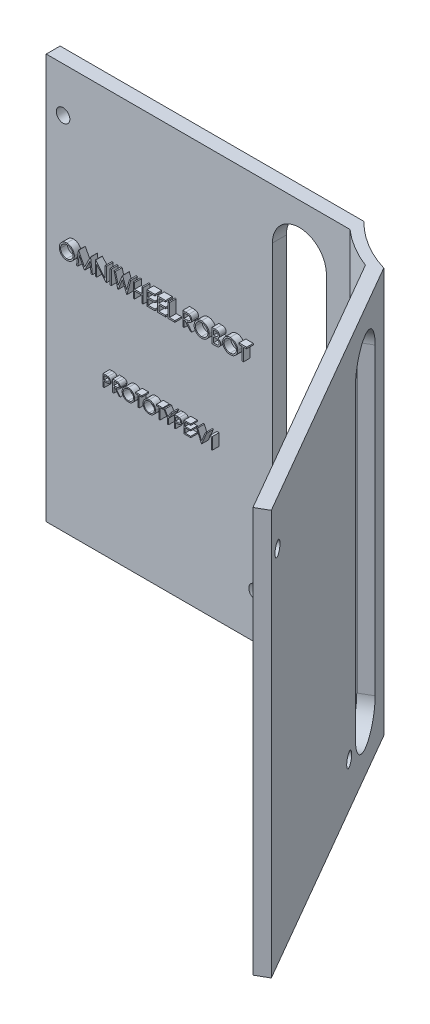
from build123d import *

# Parameters (mm, degrees)
BOSS_EXTRU_1_DEPTH      = 120
ENL_V_MAT_EXTRU_1_DEPTH = 188.009777727
ENL_V_MAT_EXTRU_2_DEPTH = 180.784310366
ESQUISSE6_R             = 2
ENL_V_MAT_EXTRU_3_DEPTH = 188.009777727
ESQUISSE7_R             = 2
ENL_V_MAT_EXTRU_4_DEPTH = 180.784310366
ESQUISSE8_W             = 0.379914529
ESQUISSE8_H             = 4.233333333
BOSS_EXTRU_2_DEPTH      = 2
ESQUISSE9_R             = 2
ENL_V_MAT_EXTRU_5_DEPTH = 188.009777853
ESQUISSE10_R            = 2
ENL_V_MAT_EXTRU_6_DEPTH = 180.784310483


with BuildPart() as part:
    # Esquisse3 → Boss.-Extru.1 (new body)
    with BuildSketch(Plane(origin=(0, 0, 0), x_dir=(1, 0, 0), z_dir=(0, 1, 0))):
        with BuildLine():
            ThreePointArc((-10.103808925, -33.509894736), (-18.121448463, -29.943498553), (-25, -24.494897428))
            Line((-25, -24.494897428), (-115, -24.494897428))
            Line((-115, -24.494897428), (-115, -28.618176043))
            Line((-115, -28.618176043), (-25, -28.618176043))
            ThreePointArc((-25, -28.618176043), (-19.581111, -32.566548666), (-13.552631037, -35.50107311))
            Line((-13.552631037, -35.50107311), (31.963111135, -114.336651096))
            Line((31.963111135, -114.336651096), (35.411933246, -112.345472721))
            Line((35.411933246, -112.345472721), (-10.103808925, -33.509894736))
        make_face()
    extrude(amount=BOSS_EXTRU_1_DEPTH)

    # Esquisse4 → Enlèv. mat.-Extru.1 (cut, through all)
    with BuildSketch(Plane.XY.offset(28.618176043)):
        with BuildLine():
            Line((-48, 105), (-48, 15))
            ThreePointArc((-48, 15), (-40, 7), (-32, 15))
            Line((-32, 15), (-32, 105))
            ThreePointArc((-32, 105), (-40, 113), (-48, 105))
        make_face()
    extrude(amount=-ENL_V_MAT_EXTRU_1_DEPTH, mode=Mode.SUBTRACT)

    # Esquisse5 → Enlèv. mat.-Extru.2 (cut, through all)
    with BuildSketch(Plane(origin=(-25.536888865, 0, 14.743729661), x_dir=(0.4999999999999999, 0, 0.8660254037844386), z_dir=(-0.8660254037844387, 0, 0.49999999999999994))):
        with BuildLine():
            Line((46.968515657, 105), (46.968515657, 15))
            ThreePointArc((46.968515657, 15), (38.968515657, 7), (30.968515657, 15))
            Line((30.968515657, 15), (30.968515657, 105))
            ThreePointArc((30.968515657, 105), (38.968515657, 113), (46.968515657, 105))
        make_face()
    extrude(amount=-ENL_V_MAT_EXTRU_2_DEPTH, mode=Mode.SUBTRACT)

    # Esquisse6 → Enlèv. mat.-Extru.3 (cut, through all)
    with BuildSketch(Plane.XY.offset(28.618176043)):
        with Locations((-110, 106.75)):
            Circle(ESQUISSE6_R)
    extrude(amount=-ENL_V_MAT_EXTRU_3_DEPTH, mode=Mode.SUBTRACT)

    # Esquisse7 → Enlèv. mat.-Extru.4 (cut, through all)
    with BuildSketch(Plane(origin=(-25.536888865, 0, 14.743729661), x_dir=(0.4999999999999999, 0, 0.8660254037844386), z_dir=(-0.8660254037844387, 0, 0.49999999999999994))):
        with Locations((110, 106.75)):
            Circle(ESQUISSE7_R)
    extrude(amount=-ENL_V_MAT_EXTRU_4_DEPTH, mode=Mode.SUBTRACT)

    # Esquisse8 → Boss.-Extru.2 (add)
    # profile 1 of 25: a face of its own
    with BuildSketch(Plane.XY.offset(28.618176043)):
        with BuildLine():
            add(Edge.make_bspline(
                [(-106.927136752, 76.562203816), (-106.848749805, 76.560218407), (-106.694791374, 76.556318902), (-106.468519831, 76.526468938), (-106.252504811, 76.474827848), (-106.044986643, 76.406050716), (-105.848447519, 76.314303031), (-105.661408096, 76.203407661), (-105.484313401, 76.072202802), (-105.319550397, 75.921702689), (-105.168774848, 75.757953178), (-105.035937823, 75.583203706), (-104.924610477, 75.398510869), (-104.833187668, 75.204429674), (-104.761464588, 75.001399046), (-104.71197203, 74.788336585), (-104.680357315, 74.566622779), (-104.67666128, 74.41539981), (-104.674786325, 74.338686188)],
                knots=[0, 0, 0, 0, 1.065120563, 2.091984664, 3.0946048, 4.079830382, 5.057816894, 6.036188127, 7.030412546, 8.04752943, 9.064399622, 10.05169764, 11.02544977, 11.989514704, 12.962713494, 13.945757189, 14.957906945, 16, 16, 16, 16], degree=3))
            add(Edge.make_bspline(
                [(-104.674786325, 74.338686188), (-104.676661005, 74.262537657), (-104.680356217, 74.112440082), (-104.712007977, 73.89213325), (-104.761648043, 73.680356883), (-104.832521622, 73.477464522), (-104.92350863, 73.283242136), (-105.035577265, 73.098200773), (-105.167586158, 72.92227977), (-105.317817302, 72.757406356), (-105.481588086, 72.606218939), (-105.657247552, 72.474478965), (-105.840845186, 72.361117405), (-106.034743595, 72.270664771), (-106.236371259, 72.19836921), (-106.447532735, 72.149077934), (-106.667238567, 72.117283129), (-106.817063496, 72.113632162), (-106.893215812, 72.111776465)],
                knots=[0, 0, 0, 0, 1.043624062, 2.057103931, 3.04512605, 4.022047818, 4.998200453, 5.980619268, 6.982898556, 8.009068085, 9.034988726, 10.034168286, 11.015286542, 11.987931943, 12.962482838, 13.94673481, 14.956375938, 16, 16, 16, 16], degree=3))
            add(Edge.make_bspline(
                [(-106.893215812, 72.111776465), (-106.969929036, 72.113650486), (-107.121151221, 72.117344679), (-107.343143635, 72.149011711), (-107.556355763, 72.198531193), (-107.760177883, 72.269299749), (-107.954723655, 72.36076059), (-108.140373565, 72.472283982), (-108.316382438, 72.604614524), (-108.481291027, 72.754796952), (-108.632178152, 72.918290163), (-108.763725207, 73.093470643), (-108.875273677, 73.276901528), (-108.966427422, 73.469091867), (-109.038593006, 73.669112564), (-109.087826453, 73.878297866), (-109.119680414, 74.095455173), (-109.123351133, 74.243310869), (-109.125213675, 74.318333624)],
                knots=[0, 0, 0, 0, 1.053102029, 2.075944431, 3.073151272, 4.055350789, 5.033113405, 6.020478099, 7.024410459, 8.052272461, 9.079885166, 10.07527673, 11.055994387, 12.023226415, 12.992069828, 13.970394897, 14.97016774, 16, 16, 16, 16], degree=3))
            add(Edge.make_bspline(
                [(-109.125213675, 74.318333624), (-109.124567021, 74.368689328), (-109.12328187, 74.468765478), (-109.107810013, 74.617375556), (-109.085359194, 74.763595685), (-109.053183547, 74.907010069), (-109.011102198, 75.047267641), (-108.961448793, 75.185335707), (-108.900803456, 75.319815068), (-108.832246863, 75.451342789), (-108.7557302, 75.577868542), (-108.671213817, 75.697465752), (-108.581666276, 75.811138006), (-108.483497219, 75.91593962), (-108.37994209, 76.014919375), (-108.269321004, 76.106556186), (-108.152308956, 76.191676364), (-108.028402459, 76.268384777), (-107.900654641, 76.337762016), (-107.768965586, 76.397297017), (-107.635123828, 76.448394634), (-107.498502492, 76.489809727), (-107.359464377, 76.522505618), (-107.217706028, 76.544769751), (-107.073340379, 76.560281069), (-106.976080974, 76.561560143), (-106.927136752, 76.562203816)],
                knots=[0, 0, 0, 0, 1.037015668, 2.060948919, 3.074880161, 4.083647147, 5.086022904, 6.090072063, 7.104153813, 8.122640571, 9.144368836, 10.147691507, 11.138137339, 12.123020368, 13.103399296, 14.087645067, 15.080126199, 16.082011238, 17.087798457, 18.072939717, 19.057185487, 20.037253025, 21.01195951, 21.997135196, 22.992090687, 24, 24, 24, 24], degree=3))
        make_face()
        with BuildLine():
            add(Edge.make_bspline(
                [(-106.908480235, 76.128015782), (-106.948654125, 76.127526057), (-107.02861784, 76.12655129), (-107.147495327, 76.11371133), (-107.26480938, 76.095411369), (-107.380584228, 76.069308005), (-107.494335454, 76.033743103), (-107.607123357, 75.992811719), (-107.717919432, 75.942953829), (-107.826357907, 75.886623034), (-107.93148376, 75.824273387), (-108.030680075, 75.755364678), (-108.124203654, 75.681512903), (-108.21182551, 75.602545709), (-108.293288356, 75.518060953), (-108.370195567, 75.429339435), (-108.439464489, 75.333845243), (-108.502947044, 75.234167894), (-108.559755765, 75.130437219), (-108.610271956, 75.02374529), (-108.651594138, 74.913221803), (-108.685294346, 74.800065822), (-108.713234117, 74.684456561), (-108.730934197, 74.56551701), (-108.743915241, 74.443844827), (-108.744834292, 74.361619156), (-108.745299145, 74.320029671)],
                knots=[0, 0, 0, 0, 1.008559885, 2.007477868, 2.99961109, 3.989939068, 4.984837346, 5.991145699, 7.001802488, 8.033829008, 9.059044045, 10.069351652, 11.065060232, 12.050310815, 13.029377138, 14.011219647, 14.996725999, 15.989392538, 16.977580475, 17.965360261, 18.951710183, 19.937753436, 20.929683414, 21.935841486, 22.955955122, 24, 24, 24, 24], degree=3))
            add(Edge.make_bspline(
                [(-108.745299145, 74.320029671), (-108.743757169, 74.258873461), (-108.740723626, 74.138560276), (-108.714165422, 73.962250236), (-108.673256939, 73.792810118), (-108.612953267, 73.631167047), (-108.537538714, 73.475931581), (-108.444372856, 73.328480826), (-108.333992819, 73.18877493), (-108.208609316, 73.057789224), (-108.071542804, 72.93823287), (-107.925997502, 72.833290461), (-107.773532662, 72.744499016), (-107.613750693, 72.672163357), (-107.447504622, 72.614844341), (-107.273723203, 72.575560664), (-107.093564076, 72.549706541), (-106.970760331, 72.547223684), (-106.908480235, 72.5459645)],
                knots=[0, 0, 0, 0, 1.032063989, 2.030389145, 3.003944642, 3.970395727, 4.937377036, 5.913328081, 6.909231446, 7.93887556, 8.970685674, 9.976071282, 10.964166581, 11.944589148, 12.933237628, 13.927779006, 14.949070134, 16, 16, 16, 16], degree=3))
            add(Edge.make_bspline(
                [(-106.908480235, 72.5459645), (-106.866619219, 72.546539633), (-106.783596251, 72.547680297), (-106.660109286, 72.559169172), (-106.538847011, 72.577592481), (-106.41997951, 72.604118131), (-106.303641691, 72.637316181), (-106.189347977, 72.676756004), (-106.078315759, 72.725960889), (-105.969144336, 72.780326506), (-105.864646025, 72.842302697), (-105.764889905, 72.908872649), (-105.672390386, 72.982615648), (-105.584834081, 73.060409573), (-105.503036781, 73.143822989), (-105.427551628, 73.232747448), (-105.358632802, 73.327744243), (-105.295174353, 73.427270401), (-105.238564692, 73.531284916), (-105.189241401, 73.638363669), (-105.147396575, 73.748242992), (-105.113616384, 73.861081369), (-105.087145397, 73.976664491), (-105.068905875, 74.095147118), (-105.056147287, 74.216292228), (-105.055185622, 74.298230035), (-105.054700855, 74.339534211)],
                knots=[0, 0, 0, 0, 1.047197238, 2.076906641, 3.100256066, 4.114471768, 5.12198147, 6.126382909, 7.136867548, 8.15857795, 9.17633901, 10.174870724, 11.156907918, 12.133735059, 13.104061851, 14.077631395, 15.04955518, 16.038496417, 17.029181396, 18.010275684, 18.986308667, 19.968651475, 20.955262928, 21.950658345, 22.966943676, 24, 24, 24, 24], degree=3))
            add(Edge.make_bspline(
                [(-105.054700855, 74.339534211), (-105.05518601, 74.380555821), (-105.056148406, 74.461929741), (-105.06889978, 74.582229969), (-105.087164667, 74.699860044), (-105.11348718, 74.814358167), (-105.147414509, 74.925753526), (-105.189248709, 75.033941497), (-105.238579499, 75.139325124), (-105.295195161, 75.24164394), (-105.358835252, 75.339826718), (-105.428375909, 75.433688684), (-105.505017806, 75.521467142), (-105.586571188, 75.605329106), (-105.675073116, 75.683485982), (-105.770122691, 75.755963697), (-105.870565997, 75.824511372), (-105.976916081, 75.886348956), (-106.086673054, 75.943455695), (-106.199296603, 75.992382146), (-106.313510847, 76.033956043), (-106.429025345, 76.06941561), (-106.546812376, 76.095309132), (-106.666076055, 76.113727821), (-106.786651377, 76.126546821), (-106.867741748, 76.127524574), (-106.908480235, 76.128015782)],
                knots=[0, 0, 0, 0, 1.02996197, 2.043119294, 3.035359645, 4.018872909, 4.991431989, 5.957985074, 6.929999688, 7.912076566, 8.892894881, 9.867085534, 10.843653904, 11.817741046, 12.803660682, 13.806313499, 14.818574707, 15.856120519, 16.894564902, 17.924820532, 18.937903209, 19.946497019, 20.957711757, 21.963978472, 22.977135795, 24, 24, 24, 24], degree=3))
        make_face(mode=Mode.SUBTRACT)
    # profile 2 of 25: a face of its own
    with BuildSketch(Plane.XY.offset(28.618176043)):
        Polygon((-104.023504274, 72.220323474), (-103.464656784, 76.453656807), (-103.41038328, 76.453656807), (-101.662606838, 72.980152534), (-99.919070513, 76.453656807), (-99.863948985, 76.453656807), (-99.301709402, 72.220323474), (-99.683319979, 72.220323474), (-100.088675214, 75.266423901), (-101.616813568, 72.220323474), (-101.702463942, 72.220323474), (-103.236538462, 75.273208089), (-103.641045673, 72.220323474), align=None)
    # profile 3 of 25: a face of its own
    with BuildSketch(Plane.XY.offset(28.618176043)):
        Polygon((-98.433333333, 72.220323474), (-98.433333333, 76.453656807), (-98.353619124, 76.453656807), (-95.556837607, 73.121772459), (-95.556837607, 76.453656807), (-95.176923077, 76.453656807), (-95.176923077, 72.220323474), (-95.263421474, 72.220323474), (-98.053418803, 75.544575611), (-98.053418803, 72.220323474), align=None)
    # profile 4 of 25: a face of its own
    with BuildSketch(Plane.XY.offset(28.618176043)):
        with Locations((-93.901495727, 74.336990141)):
            Rectangle(ESQUISSE8_W, ESQUISSE8_H)
    # profile 5 of 25: a face of its own
    with BuildSketch(Plane.XY.offset(28.618176043)):
        Polygon((-92.897435897, 76.453656807), (-92.504801015, 76.453656807), (-91.676282051, 73.349042758), (-90.4441039, 76.453656807), (-90.388982372, 76.453656807), (-89.179700855, 73.370243346), (-88.346941774, 76.453656807), (-87.958547009, 76.453656807), (-89.099986645, 72.220323474), (-89.15426015, 72.220323474), (-90.427991453, 75.458077213), (-91.716987179, 72.220323474), (-91.771260684, 72.220323474), align=None)
    # profile 6 of 25: a face of its own
    with BuildSketch(Plane.XY.offset(28.618176043)):
        Polygon((-87.198717949, 76.453656807), (-86.818803419, 76.453656807), (-86.818803419, 74.716904671), (-84.647863248, 74.716904671), (-84.647863248, 76.453656807), (-84.267948718, 76.453656807), (-84.267948718, 72.220323474), (-84.647863248, 72.220323474), (-84.647863248, 74.282716636), (-86.818803419, 74.282716636), (-86.818803419, 72.220323474), (-87.198717949, 72.220323474), align=None)
    # profile 7 of 25: a face of its own
    with BuildSketch(Plane.XY.offset(28.618176043)):
        Polygon((-83.182478632, 76.453656807), (-80.794444444, 76.453656807), (-80.794444444, 76.019468773), (-82.802564103, 76.019468773), (-82.802564103, 74.716904671), (-80.794444444, 74.716904671), (-80.794444444, 74.282716636), (-82.802564103, 74.282716636), (-82.802564103, 72.654511508), (-80.794444444, 72.654511508), (-80.794444444, 72.220323474), (-83.182478632, 72.220323474), align=None)
    # profile 8 of 25: a face of its own
    with BuildSketch(Plane.XY.offset(28.618176043)):
        Polygon((-80.034615385, 76.453656807), (-77.646581197, 76.453656807), (-77.646581197, 76.019468773), (-79.654700855, 76.019468773), (-79.654700855, 74.716904671), (-77.646581197, 74.716904671), (-77.646581197, 74.282716636), (-79.654700855, 74.282716636), (-79.654700855, 72.654511508), (-77.646581197, 72.654511508), (-77.646581197, 72.220323474), (-80.034615385, 72.220323474), align=None)
    # profile 9 of 25: a face of its own
    with BuildSketch(Plane.XY.offset(28.618176043)):
        Polygon((-76.886752137, 76.453656807), (-76.506837607, 76.453656807), (-76.506837607, 72.654511508), (-74.878632479, 72.654511508), (-74.878632479, 72.220323474), (-76.886752137, 72.220323474), align=None)
    # profile 10 of 25: a face of its own
    with BuildSketch(Plane.XY.offset(28.618176043)):
        with BuildLine():
            Line((-72.544871795, 76.453656807), (-71.697696314, 76.453656807))
            add(Edge.make_bspline(
                [(-71.697696314, 76.453656807), (-71.641161806, 76.453468622), (-71.532609289, 76.453107286), (-71.377096857, 76.451092506), (-71.235791702, 76.44531781), (-71.108767705, 76.44034838), (-70.996027199, 76.431286699), (-70.897224476, 76.422625725), (-70.812814594, 76.41128806), (-70.761717231, 76.400758643), (-70.738581731, 76.395991209)],
                knots=[0, 0, 0, 0, 1.410062039, 2.707475311, 3.878576406, 4.937260626, 5.877586885, 6.699081471, 7.410979367, 8, 8, 8, 8], degree=3))
            add(Edge.make_bspline(
                [(-70.738581731, 76.395991209), (-70.707609909, 76.388338836), (-70.646326979, 76.373197335), (-70.558092137, 76.341193818), (-70.474012907, 76.304158653), (-70.394438548, 76.260659677), (-70.319767639, 76.210373991), (-70.249230254, 76.15416969), (-70.182506312, 76.092354308), (-70.122294245, 76.023369309), (-70.065520345, 75.950995626), (-70.017636958, 75.872734892), (-69.976360169, 75.790896663), (-69.943496781, 75.704648644), (-69.917034851, 75.614827262), (-69.898376448, 75.520618908), (-69.887186916, 75.422452776), (-69.886047719, 75.355496068), (-69.885470085, 75.321545429)],
                knots=[0, 0, 0, 0, 1.027469482, 2.033020251, 3.019912614, 3.986113645, 4.951240523, 5.91722682, 6.890402269, 7.87763091, 8.8651537, 9.85103654, 10.82876324, 11.815024772, 12.821070561, 13.842952187, 14.906261191, 16, 16, 16, 16], degree=3))
            add(Edge.make_bspline(
                [(-69.885470085, 75.321545429), (-69.887246874, 75.26513916), (-69.890713848, 75.155075919), (-69.923038497, 74.995345138), (-69.97598724, 74.846344729), (-70.048949694, 74.7082623), (-70.141864679, 74.583789425), (-70.253533712, 74.474460017), (-70.38401909, 74.382971741), (-70.505490739, 74.319528825), (-70.612792675, 74.278897402), (-70.701128206, 74.250308664), (-70.797487312, 74.228220382), (-70.900946755, 74.208432413), (-71.011937081, 74.193492744), (-71.130192272, 74.182550673), (-71.255796665, 74.175711967), (-71.342082967, 74.174693542), (-71.386471688, 74.174169628)],
                knots=[0, 0, 0, 0, 1.260483769, 2.459530307, 3.627416485, 4.787058657, 5.939039949, 7.08810263, 8.267026773, 9.491475466, 10.141966685, 10.831826277, 11.566392101, 12.351337768, 13.187381173, 14.07005841, 15.007169909, 16, 16, 16, 16], degree=3))
            Line((-71.386471688, 74.174169628), (-69.831196581, 72.220323474))
            Line((-69.831196581, 72.220323474), (-70.301001603, 72.220323474))
            Line((-70.301001603, 72.220323474), (-71.856276709, 74.174169628))
            Line((-71.856276709, 74.174169628), (-72.164957265, 74.174169628))
            Line((-72.164957265, 74.174169628), (-72.164957265, 72.220323474))
            Line((-72.164957265, 72.220323474), (-72.544871795, 72.220323474))
            Line((-72.544871795, 72.220323474), (-72.544871795, 76.453656807))
        make_face()
        with BuildLine():
            Line((-72.164957265, 76.019468773), (-72.164957265, 74.608357662))
            Line((-72.164957265, 74.608357662), (-71.389863782, 74.602421497))
            add(Edge.make_bspline(
                [(-71.389863782, 74.602421497), (-71.353674783, 74.602405487), (-71.283530194, 74.602374455), (-71.182050343, 74.607205023), (-71.087562208, 74.612700274), (-71.000427203, 74.621105673), (-70.920606402, 74.631938255), (-70.848139702, 74.645488531), (-70.782908811, 74.661275312), (-70.706831531, 74.685709659), (-70.621878774, 74.724421701), (-70.529554056, 74.78074378), (-70.450932181, 74.851584524), (-70.384507719, 74.932590514), (-70.331132121, 75.02165531), (-70.29350135, 75.117711299), (-70.269622396, 75.218333518), (-70.266805965, 75.287491801), (-70.265384615, 75.322393453)],
                knots=[0, 0, 0, 0, 1.146690395, 2.22261258, 3.21895312, 4.145990853, 4.996080663, 5.770904154, 6.481378293, 7.121626537, 8.300444488, 9.431385265, 10.535395872, 11.636531494, 12.74115979, 13.810798291, 14.895190096, 16, 16, 16, 16], degree=3))
            add(Edge.make_bspline(
                [(-70.265384615, 75.322393453), (-70.266838609, 75.356437404), (-70.269719895, 75.423900092), (-70.293243644, 75.52266486), (-70.333024134, 75.615879171), (-70.386632936, 75.703163834), (-70.451946199, 75.782394581), (-70.528530601, 75.850184947), (-70.614292123, 75.906124776), (-70.694448715, 75.941871503), (-70.766093906, 75.963787897), (-70.828299304, 75.979210733), (-70.89858652, 75.991601662), (-70.977296837, 76.001529507), (-71.064094238, 76.01006263), (-71.159417597, 76.01581002), (-71.262634464, 76.019213455), (-71.334174086, 76.019381687), (-71.371207265, 76.019468773)],
                knots=[0, 0, 0, 0, 1.101028733, 2.181837193, 3.264309656, 4.369019818, 5.486613113, 6.575447106, 7.666700264, 8.788928104, 9.402425223, 10.0903467, 10.862060571, 11.710948788, 12.657782767, 13.684531032, 14.801375019, 16, 16, 16, 16], degree=3))
            Line((-71.371207265, 76.019468773), (-72.164957265, 76.019468773))
        make_face(mode=Mode.SUBTRACT)
    # profile 11 of 25: a face of its own
    with BuildSketch(Plane.XY.offset(28.618176043)):
        with BuildLine():
            add(Edge.make_bspline(
                [(-66.981837607, 76.562203816), (-66.90345066, 76.560218407), (-66.749492228, 76.556318902), (-66.523220685, 76.526468938), (-66.307205665, 76.474827848), (-66.099687497, 76.406050716), (-65.903148373, 76.314303031), (-65.716108951, 76.203407661), (-65.539014256, 76.072202802), (-65.374251252, 75.921702689), (-65.223475702, 75.757953178), (-65.090638678, 75.583203706), (-64.979311332, 75.398510869), (-64.887888523, 75.204429674), (-64.816165443, 75.001399046), (-64.766672885, 74.788336585), (-64.73505817, 74.566622779), (-64.731362135, 74.41539981), (-64.729487179, 74.338686188)],
                knots=[0, 0, 0, 0, 1.065120563, 2.091984664, 3.0946048, 4.079830382, 5.057816894, 6.036188127, 7.030412546, 8.04752943, 9.064399622, 10.05169764, 11.02544977, 11.989514704, 12.962713494, 13.945757189, 14.957906945, 16, 16, 16, 16], degree=3))
            add(Edge.make_bspline(
                [(-64.729487179, 74.338686188), (-64.73136186, 74.262537657), (-64.735057072, 74.112440082), (-64.766708831, 73.89213325), (-64.816348898, 73.680356883), (-64.887222477, 73.477464522), (-64.978209484, 73.283242136), (-65.09027812, 73.098200773), (-65.222287013, 72.92227977), (-65.372518157, 72.757406356), (-65.536288941, 72.606218939), (-65.711948406, 72.474478965), (-65.895546041, 72.361117405), (-66.08944445, 72.270664771), (-66.291072113, 72.19836921), (-66.50223359, 72.149077934), (-66.721939422, 72.117283129), (-66.87176435, 72.113632162), (-66.947916667, 72.111776465)],
                knots=[0, 0, 0, 0, 1.043624062, 2.057103931, 3.04512605, 4.022047818, 4.998200453, 5.980619268, 6.982898556, 8.009068085, 9.034988726, 10.034168286, 11.015286542, 11.987931943, 12.962482838, 13.94673481, 14.956375938, 16, 16, 16, 16], degree=3))
            add(Edge.make_bspline(
                [(-66.947916667, 72.111776465), (-67.024629891, 72.113650486), (-67.175852076, 72.117344679), (-67.39784449, 72.149011711), (-67.611056618, 72.198531193), (-67.814878738, 72.269299749), (-68.00942451, 72.36076059), (-68.19507442, 72.472283982), (-68.371083293, 72.604614524), (-68.535991882, 72.754796952), (-68.686879007, 72.918290163), (-68.818426061, 73.093470643), (-68.929974532, 73.276901528), (-69.021128277, 73.469091867), (-69.093293861, 73.669112564), (-69.142527308, 73.878297866), (-69.174381269, 74.095455173), (-69.178051988, 74.243310869), (-69.17991453, 74.318333624)],
                knots=[0, 0, 0, 0, 1.053102029, 2.075944431, 3.073151272, 4.055350789, 5.033113405, 6.020478099, 7.024410459, 8.052272461, 9.079885166, 10.07527673, 11.055994387, 12.023226415, 12.992069828, 13.970394897, 14.97016774, 16, 16, 16, 16], degree=3))
            add(Edge.make_bspline(
                [(-69.17991453, 74.318333624), (-69.179267876, 74.368689328), (-69.177982725, 74.468765478), (-69.162510868, 74.617375556), (-69.140060048, 74.763595685), (-69.107884402, 74.907010069), (-69.065803052, 75.047267641), (-69.016149648, 75.185335707), (-68.955504311, 75.319815068), (-68.886947718, 75.451342789), (-68.810431055, 75.577868542), (-68.725914672, 75.697465752), (-68.636367131, 75.811138006), (-68.538198074, 75.91593962), (-68.434642945, 76.014919375), (-68.324021859, 76.106556186), (-68.207009811, 76.191676364), (-68.083103314, 76.268384777), (-67.955355495, 76.337762016), (-67.82366644, 76.397297017), (-67.689824683, 76.448394634), (-67.553203346, 76.489809727), (-67.414165232, 76.522505618), (-67.272406883, 76.544769751), (-67.128041234, 76.560281069), (-67.030781829, 76.561560143), (-66.981837607, 76.562203816)],
                knots=[0, 0, 0, 0, 1.037015668, 2.060948919, 3.074880161, 4.083647147, 5.086022904, 6.090072063, 7.104153813, 8.122640571, 9.144368836, 10.147691507, 11.138137339, 12.123020368, 13.103399296, 14.087645067, 15.080126199, 16.082011238, 17.087798457, 18.072939717, 19.057185487, 20.037253025, 21.01195951, 21.997135196, 22.992090687, 24, 24, 24, 24], degree=3))
        make_face()
        with BuildLine():
            add(Edge.make_bspline(
                [(-66.96318109, 76.128015782), (-67.00335498, 76.127526057), (-67.083318695, 76.12655129), (-67.202196182, 76.11371133), (-67.319510235, 76.095411369), (-67.435285082, 76.069308005), (-67.549036309, 76.033743103), (-67.661824212, 75.992811719), (-67.772620287, 75.942953829), (-67.881058762, 75.886623034), (-67.986184615, 75.824273387), (-68.08538093, 75.755364678), (-68.178904509, 75.681512903), (-68.266526365, 75.602545709), (-68.347989211, 75.518060953), (-68.424896422, 75.429339435), (-68.494165344, 75.333845243), (-68.557647899, 75.234167894), (-68.61445662, 75.130437219), (-68.664972811, 75.02374529), (-68.706294993, 74.913221803), (-68.739995201, 74.800065822), (-68.767934972, 74.684456561), (-68.785635051, 74.56551701), (-68.798616096, 74.443844827), (-68.799535147, 74.361619156), (-68.8, 74.320029671)],
                knots=[0, 0, 0, 0, 1.008559885, 2.007477868, 2.99961109, 3.989939068, 4.984837346, 5.991145699, 7.001802488, 8.033829008, 9.059044045, 10.069351652, 11.065060232, 12.050310815, 13.029377138, 14.011219647, 14.996725999, 15.989392538, 16.977580475, 17.965360261, 18.951710183, 19.937753436, 20.929683414, 21.935841486, 22.955955122, 24, 24, 24, 24], degree=3))
            add(Edge.make_bspline(
                [(-68.8, 74.320029671), (-68.798458024, 74.258873461), (-68.795424481, 74.138560276), (-68.768866277, 73.962250236), (-68.727957793, 73.792810118), (-68.667654121, 73.631167047), (-68.592239569, 73.475931581), (-68.499073711, 73.328480826), (-68.388693674, 73.18877493), (-68.26331017, 73.057789224), (-68.126243659, 72.93823287), (-67.980698357, 72.833290461), (-67.828233517, 72.744499016), (-67.668451548, 72.672163357), (-67.502205477, 72.614844341), (-67.328424058, 72.575560664), (-67.148264931, 72.549706541), (-67.025461186, 72.547223684), (-66.96318109, 72.5459645)],
                knots=[0, 0, 0, 0, 1.032063989, 2.030389145, 3.003944642, 3.970395727, 4.937377036, 5.913328081, 6.909231446, 7.93887556, 8.970685674, 9.976071282, 10.964166581, 11.944589148, 12.933237628, 13.927779006, 14.949070134, 16, 16, 16, 16], degree=3))
            add(Edge.make_bspline(
                [(-66.96318109, 72.5459645), (-66.921320074, 72.546539633), (-66.838297106, 72.547680297), (-66.714810141, 72.559169172), (-66.593547865, 72.577592481), (-66.474680365, 72.604118131), (-66.358342546, 72.637316181), (-66.244048831, 72.676756004), (-66.133016613, 72.725960889), (-66.023845191, 72.780326506), (-65.919346879, 72.842302697), (-65.819590759, 72.908872649), (-65.727091241, 72.982615648), (-65.639534935, 73.060409573), (-65.557737635, 73.143822989), (-65.482252483, 73.232747448), (-65.413333656, 73.327744243), (-65.349875208, 73.427270401), (-65.293265547, 73.531284916), (-65.243942256, 73.638363669), (-65.20209743, 73.748242992), (-65.168317238, 73.861081369), (-65.141846251, 73.976664491), (-65.123606729, 74.095147118), (-65.110848142, 74.216292228), (-65.109886477, 74.298230035), (-65.109401709, 74.339534211)],
                knots=[0, 0, 0, 0, 1.047197238, 2.076906641, 3.100256066, 4.114471768, 5.12198147, 6.126382909, 7.136867548, 8.15857795, 9.17633901, 10.174870724, 11.156907918, 12.133735059, 13.104061851, 14.077631395, 15.04955518, 16.038496417, 17.029181396, 18.010275684, 18.986308667, 19.968651475, 20.955262928, 21.950658345, 22.966943676, 24, 24, 24, 24], degree=3))
            add(Edge.make_bspline(
                [(-65.109401709, 74.339534211), (-65.109886865, 74.380555821), (-65.110849261, 74.461929741), (-65.123600635, 74.582229969), (-65.141865521, 74.699860044), (-65.168188035, 74.814358167), (-65.202115364, 74.925753526), (-65.243949563, 75.033941497), (-65.293280354, 75.139325124), (-65.349896016, 75.24164394), (-65.413536107, 75.339826718), (-65.483076763, 75.433688684), (-65.559718661, 75.521467142), (-65.641272043, 75.605329106), (-65.729773971, 75.683485982), (-65.824823546, 75.755963697), (-65.925266851, 75.824511372), (-66.031616936, 75.886348956), (-66.141373909, 75.943455695), (-66.253997458, 75.992382146), (-66.368211702, 76.033956043), (-66.4837262, 76.06941561), (-66.601513231, 76.095309132), (-66.72077691, 76.113727821), (-66.841352232, 76.126546821), (-66.922442602, 76.127524574), (-66.96318109, 76.128015782)],
                knots=[0, 0, 0, 0, 1.02996197, 2.043119294, 3.035359645, 4.018872909, 4.991431989, 5.957985074, 6.929999688, 7.912076566, 8.892894881, 9.867085534, 10.843653904, 11.817741046, 12.803660682, 13.806313499, 14.818574707, 15.856120519, 16.894564902, 17.924820532, 18.937903209, 19.946497019, 20.957711757, 21.963978472, 22.977135795, 24, 24, 24, 24], degree=3))
        make_face(mode=Mode.SUBTRACT)
    # profile 12 of 25: a face of its own
    with BuildSketch(Plane.XY.offset(28.618176043)):
        with BuildLine():
            Line((-63.861111111, 76.453656807), (-63.035136218, 76.453656807))
            add(Edge.make_bspline(
                [(-63.035136218, 76.453656807), (-62.994703678, 76.453444233), (-62.916335352, 76.453032211), (-62.802374694, 76.446642138), (-62.695635656, 76.437929128), (-62.596087284, 76.424104159), (-62.503775577, 76.407422676), (-62.41842234, 76.387221432), (-62.340298988, 76.362998766), (-62.247029298, 76.32447993), (-62.140687165, 76.267241431), (-62.025542442, 76.182661167), (-61.927082077, 76.079207616), (-61.842190055, 75.962509547), (-61.774697272, 75.834135804), (-61.725869646, 75.697146119), (-61.694956787, 75.553307441), (-61.691777633, 75.454558073), (-61.69017094, 75.404651733)],
                knots=[0, 0, 0, 0, 1.001505555, 1.941167018, 2.826882275, 3.653841531, 4.429895133, 5.150066043, 5.825578002, 6.45369114, 7.647487171, 8.808567382, 9.977351308, 11.170798116, 12.373658725, 13.556498008, 14.765093433, 16, 16, 16, 16], degree=3))
            add(Edge.make_bspline(
                [(-61.69017094, 75.404651733), (-61.691493214, 75.357900546), (-61.694091606, 75.266030056), (-61.718938563, 75.131659086), (-61.757837657, 75.003750469), (-61.811909721, 74.882771012), (-61.882185468, 74.771454166), (-61.965471244, 74.668901949), (-62.065954615, 74.579456384), (-62.141239296, 74.529451159), (-62.179480502, 74.504050771)],
                knots=[0, 0, 0, 0, 1.044552857, 2.05264487, 3.044412934, 4.028983338, 5.005914585, 5.980388656, 6.974128949, 8, 8, 8, 8], degree=3))
            add(Edge.make_bspline(
                [(-62.179480502, 74.504050771), (-62.131389318, 74.485587391), (-62.039378971, 74.450262372), (-61.912758746, 74.387808049), (-61.803665933, 74.319878639), (-61.711261766, 74.245696306), (-61.632234317, 74.165736126), (-61.563227426, 74.078825654), (-61.504346145, 73.983831157), (-61.453893371, 73.881743071), (-61.414524875, 73.773603819), (-61.385041638, 73.660427737), (-61.368147676, 73.542620656), (-61.365743577, 73.462446912), (-61.364529915, 73.42197278)],
                knots=[0, 0, 0, 0, 1.27268992, 2.434971085, 3.483601985, 4.442670788, 5.356604649, 6.2567628, 7.179492994, 8.113709626, 9.066344395, 10.018646069, 10.999752585, 12, 12, 12, 12], degree=3))
            add(Edge.make_bspline(
                [(-61.364529915, 73.42197278), (-61.365711433, 73.380647134), (-61.368036104, 73.299337769), (-61.385187117, 73.179891083), (-61.414226704, 73.065742338), (-61.454227043, 72.956153212), (-61.50643289, 72.851335716), (-61.569966714, 72.751171101), (-61.645721081, 72.656665768), (-61.730463789, 72.566769577), (-61.826333241, 72.485939777), (-61.929766583, 72.413954112), (-62.042066418, 72.354752685), (-62.161388353, 72.305021878), (-62.289070907, 72.267034124), (-62.424540727, 72.240457772), (-62.567680978, 72.222550727), (-62.665906106, 72.221078489), (-62.71627938, 72.220323474)],
                knots=[0, 0, 0, 0, 0.978564426, 1.925352924, 2.850884081, 3.763762016, 4.682927383, 5.618979971, 6.567305752, 7.547517671, 8.540179244, 9.531824382, 10.526200242, 11.540722885, 12.589160233, 13.674978461, 14.80764778, 16, 16, 16, 16], degree=3))
            Line((-62.71627938, 72.220323474), (-63.861111111, 72.220323474))
            Line((-63.861111111, 72.220323474), (-63.861111111, 76.453656807))
        make_face()
        with BuildLine():
            Line((-63.481196581, 76.019468773), (-63.481196581, 74.662631166))
            Line((-63.481196581, 74.662631166), (-63.225941506, 74.662631166))
            add(Edge.make_bspline(
                [(-63.225941506, 74.662631166), (-63.188629154, 74.663114883), (-63.116534085, 74.664049521), (-63.012128115, 74.666726823), (-62.915214998, 74.674223504), (-62.825962019, 74.68171803), (-62.744509729, 74.693903484), (-62.671038583, 74.708408242), (-62.604395518, 74.723748518), (-62.527542925, 74.749837326), (-62.440368977, 74.788394133), (-62.347437508, 74.848231497), (-62.265511055, 74.919501905), (-62.196329694, 75.001738592), (-62.139710106, 75.092291026), (-62.100383994, 75.189714396), (-62.073717278, 75.291580651), (-62.071308474, 75.361513204), (-62.07008547, 75.397019521)],
                knots=[0, 0, 0, 0, 1.156816544, 2.235205308, 3.236616184, 4.169592532, 5.011045266, 5.787822928, 6.49130361, 7.128639758, 8.301311294, 9.436451833, 10.541879658, 11.654887649, 12.756523258, 13.837046038, 14.901820046, 16, 16, 16, 16], degree=3))
            add(Edge.make_bspline(
                [(-62.07008547, 75.397019521), (-62.070721898, 75.420515454), (-62.07197032, 75.466605293), (-62.08219479, 75.533793559), (-62.099572714, 75.596983622), (-62.121893621, 75.65704145), (-62.153085654, 75.712089117), (-62.189810986, 75.764029935), (-62.234183201, 75.811095068), (-62.284689665, 75.855084843), (-62.342757238, 75.894085367), (-62.408351276, 75.928243242), (-62.482359229, 75.955748753), (-62.563533825, 75.979837814), (-62.653124569, 75.996756988), (-62.7500976, 76.010852038), (-62.855247212, 76.018027831), (-62.927994146, 76.018977746), (-62.965598291, 76.019468773)],
                knots=[0, 0, 0, 0, 0.91205012, 1.789085906, 2.630437955, 3.453916878, 4.269457761, 5.079663411, 5.91843418, 6.774407191, 7.675494373, 8.627863946, 9.638891023, 10.736472738, 11.911756761, 13.175263542, 14.539845004, 16, 16, 16, 16], degree=3))
            Line((-62.965598291, 76.019468773), (-63.481196581, 76.019468773))
        make_face(mode=Mode.SUBTRACT)
        with BuildLine():
            Line((-63.481196581, 74.228443132), (-63.481196581, 72.654511508))
            Line((-63.481196581, 72.654511508), (-62.940157585, 72.654511508))
            add(Edge.make_bspline(
                [(-62.940157585, 72.654511508), (-62.901429932, 72.65497566), (-62.826787486, 72.655870251), (-62.719017427, 72.658790712), (-62.619131197, 72.66543375), (-62.527584594, 72.675891111), (-62.443389094, 72.687234569), (-62.36755473, 72.702488213), (-62.299466772, 72.719964575), (-62.220515943, 72.746978288), (-62.131611699, 72.788944496), (-62.035804283, 72.852219798), (-61.950622095, 72.927601323), (-61.87828621, 73.014845381), (-61.819003833, 73.109709938), (-61.775877711, 73.210276219), (-61.749279247, 73.314882523), (-61.746059289, 73.386204166), (-61.744444444, 73.42197278)],
                knots=[0, 0, 0, 0, 1.160039823, 2.235823828, 3.228722157, 4.157150951, 4.99529583, 5.772374946, 6.472645482, 7.099169577, 8.269452708, 9.405989375, 10.527446681, 11.663510218, 12.788923519, 13.866172445, 14.929861265, 16, 16, 16, 16], degree=3))
            add(Edge.make_bspline(
                [(-61.744444444, 73.42197278), (-61.744778399, 73.444340915), (-61.745440922, 73.488716386), (-61.755432332, 73.553928854), (-61.769963394, 73.617097291), (-61.788749033, 73.678393224), (-61.816107817, 73.736708451), (-61.848047162, 73.793196309), (-61.885495714, 73.84793147), (-61.943848182, 73.917131052), (-62.028722868, 73.996859249), (-62.149320587, 74.074918895), (-62.28644708, 74.137871956), (-62.385903191, 74.164601799), (-62.437279647, 74.178409745)],
                knots=[0, 0, 0, 0, 0.723448775, 1.435228256, 2.130040452, 2.821711965, 3.505591119, 4.210454504, 4.921174351, 5.648778258, 7.137944449, 8.670945889, 10.280296675, 12, 12, 12, 12], degree=3))
            add(Edge.make_bspline(
                [(-62.437279647, 74.178409745), (-62.457876744, 74.182588752), (-62.502535499, 74.191649699), (-62.575358001, 74.201214255), (-62.658495671, 74.209735423), (-62.752140484, 74.216038442), (-62.856410921, 74.222553594), (-62.97152967, 74.22508733), (-63.097026612, 74.228110245), (-63.184103101, 74.228329331), (-63.2293336, 74.228443132)],
                knots=[0, 0, 0, 0, 0.634451884, 1.375622551, 2.216452059, 3.157844607, 4.20941857, 5.370758133, 6.634282058, 8, 8, 8, 8], degree=3))
            Line((-63.2293336, 74.228443132), (-63.481196581, 74.228443132))
        make_face(mode=Mode.SUBTRACT)
    # profile 13 of 25: a face of its own
    with BuildSketch(Plane.XY.offset(28.618176043)):
        with BuildLine():
            add(Edge.make_bspline(
                [(-58.51517094, 76.562203816), (-58.436783993, 76.560218407), (-58.282825562, 76.556318902), (-58.056554019, 76.526468938), (-57.840538999, 76.474827848), (-57.633020831, 76.406050716), (-57.436481707, 76.314303031), (-57.249442284, 76.203407661), (-57.072347589, 76.072202802), (-56.907584585, 75.921702689), (-56.756809036, 75.757953178), (-56.623972011, 75.583203706), (-56.512644666, 75.398510869), (-56.421221856, 75.204429674), (-56.349498776, 75.001399046), (-56.300006218, 74.788336585), (-56.268391503, 74.566622779), (-56.264695468, 74.41539981), (-56.262820513, 74.338686188)],
                knots=[0, 0, 0, 0, 1.065120563, 2.091984664, 3.0946048, 4.079830382, 5.057816894, 6.036188127, 7.030412546, 8.04752943, 9.064399622, 10.05169764, 11.02544977, 11.989514704, 12.962713494, 13.945757189, 14.957906945, 16, 16, 16, 16], degree=3))
            add(Edge.make_bspline(
                [(-56.262820513, 74.338686188), (-56.264695193, 74.262537657), (-56.268390405, 74.112440082), (-56.300042165, 73.89213325), (-56.349682231, 73.680356883), (-56.42055581, 73.477464522), (-56.511542818, 73.283242136), (-56.623611453, 73.098200773), (-56.755620346, 72.92227977), (-56.90585149, 72.757406356), (-57.069622274, 72.606218939), (-57.24528174, 72.474478965), (-57.428879374, 72.361117405), (-57.622777783, 72.270664771), (-57.824405447, 72.19836921), (-58.035566923, 72.149077934), (-58.255272755, 72.117283129), (-58.405097684, 72.113632162), (-58.48125, 72.111776465)],
                knots=[0, 0, 0, 0, 1.043624062, 2.057103931, 3.04512605, 4.022047818, 4.998200453, 5.980619268, 6.982898556, 8.009068085, 9.034988726, 10.034168286, 11.015286542, 11.987931943, 12.962482838, 13.94673481, 14.956375938, 16, 16, 16, 16], degree=3))
            add(Edge.make_bspline(
                [(-58.48125, 72.111776465), (-58.557963224, 72.113650486), (-58.709185409, 72.117344679), (-58.931177823, 72.149011711), (-59.144389951, 72.198531193), (-59.348212071, 72.269299749), (-59.542757843, 72.36076059), (-59.728407753, 72.472283982), (-59.904416626, 72.604614524), (-60.069325215, 72.754796952), (-60.22021234, 72.918290163), (-60.351759395, 73.093470643), (-60.463307865, 73.276901528), (-60.55446161, 73.469091867), (-60.626627194, 73.669112564), (-60.675860641, 73.878297866), (-60.707714602, 74.095455173), (-60.711385321, 74.243310869), (-60.713247863, 74.318333624)],
                knots=[0, 0, 0, 0, 1.053102029, 2.075944431, 3.073151272, 4.055350789, 5.033113405, 6.020478099, 7.024410459, 8.052272461, 9.079885166, 10.07527673, 11.055994387, 12.023226415, 12.992069828, 13.970394897, 14.97016774, 16, 16, 16, 16], degree=3))
            add(Edge.make_bspline(
                [(-60.713247863, 74.318333624), (-60.712601209, 74.368689328), (-60.711316058, 74.468765478), (-60.695844201, 74.617375556), (-60.673393382, 74.763595685), (-60.641217735, 74.907010069), (-60.599136386, 75.047267641), (-60.549482981, 75.185335707), (-60.488837644, 75.319815068), (-60.420281051, 75.451342789), (-60.343764388, 75.577868542), (-60.259248005, 75.697465752), (-60.169700464, 75.811138006), (-60.071531407, 75.91593962), (-59.967976278, 76.014919375), (-59.857355192, 76.106556186), (-59.740343144, 76.191676364), (-59.616436647, 76.268384777), (-59.488688829, 76.337762016), (-59.356999774, 76.397297017), (-59.223158016, 76.448394634), (-59.08653668, 76.489809727), (-58.947498565, 76.522505618), (-58.805740216, 76.544769751), (-58.661374567, 76.560281069), (-58.564115162, 76.561560143), (-58.51517094, 76.562203816)],
                knots=[0, 0, 0, 0, 1.037015668, 2.060948919, 3.074880161, 4.083647147, 5.086022904, 6.090072063, 7.104153813, 8.122640571, 9.144368836, 10.147691507, 11.138137339, 12.123020368, 13.103399296, 14.087645067, 15.080126199, 16.082011238, 17.087798457, 18.072939717, 19.057185487, 20.037253025, 21.01195951, 21.997135196, 22.992090687, 24, 24, 24, 24], degree=3))
        make_face()
        with BuildLine():
            add(Edge.make_bspline(
                [(-58.496514423, 76.128015782), (-58.536688313, 76.127526057), (-58.616652028, 76.12655129), (-58.735529515, 76.11371133), (-58.852843568, 76.095411369), (-58.968618416, 76.069308005), (-59.082369642, 76.033743103), (-59.195157545, 75.992811719), (-59.30595362, 75.942953829), (-59.414392096, 75.886623034), (-59.519517948, 75.824273387), (-59.618714263, 75.755364678), (-59.712237842, 75.681512903), (-59.799859698, 75.602545709), (-59.881322545, 75.518060953), (-59.958229755, 75.429339435), (-60.027498677, 75.333845243), (-60.090981232, 75.234167894), (-60.147789953, 75.130437219), (-60.198306144, 75.02374529), (-60.239628326, 74.913221803), (-60.273328534, 74.800065822), (-60.301268305, 74.684456561), (-60.318968385, 74.56551701), (-60.331949429, 74.443844827), (-60.33286848, 74.361619156), (-60.333333333, 74.320029671)],
                knots=[0, 0, 0, 0, 1.008559885, 2.007477868, 2.99961109, 3.989939068, 4.984837346, 5.991145699, 7.001802488, 8.033829008, 9.059044045, 10.069351652, 11.065060232, 12.050310815, 13.029377138, 14.011219647, 14.996725999, 15.989392538, 16.977580475, 17.965360261, 18.951710183, 19.937753436, 20.929683414, 21.935841486, 22.955955122, 24, 24, 24, 24], degree=3))
            add(Edge.make_bspline(
                [(-60.333333333, 74.320029671), (-60.331791357, 74.258873461), (-60.328757814, 74.138560276), (-60.30219961, 73.962250236), (-60.261291127, 73.792810118), (-60.200987455, 73.631167047), (-60.125572902, 73.475931581), (-60.032407044, 73.328480826), (-59.922027007, 73.18877493), (-59.796643504, 73.057789224), (-59.659576992, 72.93823287), (-59.51403169, 72.833290461), (-59.36156685, 72.744499016), (-59.201784881, 72.672163357), (-59.03553881, 72.614844341), (-58.861757392, 72.575560664), (-58.681598264, 72.549706541), (-58.558794519, 72.547223684), (-58.496514423, 72.5459645)],
                knots=[0, 0, 0, 0, 1.032063989, 2.030389145, 3.003944642, 3.970395727, 4.937377036, 5.913328081, 6.909231446, 7.93887556, 8.970685674, 9.976071282, 10.964166581, 11.944589148, 12.933237628, 13.927779006, 14.949070134, 16, 16, 16, 16], degree=3))
            add(Edge.make_bspline(
                [(-58.496514423, 72.5459645), (-58.454653407, 72.546539633), (-58.371630439, 72.547680297), (-58.248143474, 72.559169172), (-58.126881199, 72.577592481), (-58.008013698, 72.604118131), (-57.891675879, 72.637316181), (-57.777382165, 72.676756004), (-57.666349947, 72.725960889), (-57.557178524, 72.780326506), (-57.452680213, 72.842302697), (-57.352924093, 72.908872649), (-57.260424574, 72.982615648), (-57.172868269, 73.060409573), (-57.091070969, 73.143822989), (-57.015585816, 73.232747448), (-56.94666699, 73.327744243), (-56.883208541, 73.427270401), (-56.82659888, 73.531284916), (-56.777275589, 73.638363669), (-56.735430763, 73.748242992), (-56.701650572, 73.861081369), (-56.675179585, 73.976664491), (-56.656940063, 74.095147118), (-56.644181475, 74.216292228), (-56.64321981, 74.298230035), (-56.642735043, 74.339534211)],
                knots=[0, 0, 0, 0, 1.047197238, 2.076906641, 3.100256066, 4.114471768, 5.12198147, 6.126382909, 7.136867548, 8.15857795, 9.17633901, 10.174870724, 11.156907918, 12.133735059, 13.104061851, 14.077631395, 15.04955518, 16.038496417, 17.029181396, 18.010275684, 18.986308667, 19.968651475, 20.955262928, 21.950658345, 22.966943676, 24, 24, 24, 24], degree=3))
            add(Edge.make_bspline(
                [(-56.642735043, 74.339534211), (-56.643220198, 74.380555821), (-56.644182594, 74.461929741), (-56.656933968, 74.582229969), (-56.675198855, 74.699860044), (-56.701521368, 74.814358167), (-56.735448697, 74.925753526), (-56.777282897, 75.033941497), (-56.826613687, 75.139325124), (-56.883229349, 75.24164394), (-56.946869441, 75.339826718), (-57.016410097, 75.433688684), (-57.093051994, 75.521467142), (-57.174605376, 75.605329106), (-57.263107304, 75.683485982), (-57.358156879, 75.755963697), (-57.458600185, 75.824511372), (-57.564950269, 75.886348956), (-57.674707242, 75.943455695), (-57.787330791, 75.992382146), (-57.901545035, 76.033956043), (-58.017059533, 76.06941561), (-58.134846564, 76.095309132), (-58.254110243, 76.113727821), (-58.374685565, 76.126546821), (-58.455775936, 76.127524574), (-58.496514423, 76.128015782)],
                knots=[0, 0, 0, 0, 1.02996197, 2.043119294, 3.035359645, 4.018872909, 4.991431989, 5.957985074, 6.929999688, 7.912076566, 8.892894881, 9.867085534, 10.843653904, 11.817741046, 12.803660682, 13.806313499, 14.818574707, 15.856120519, 16.894564902, 17.924820532, 18.937903209, 19.946497019, 20.957711757, 21.963978472, 22.977135795, 24, 24, 24, 24], degree=3))
        make_face(mode=Mode.SUBTRACT)
    # profile 14 of 25: a face of its own
    with BuildSketch(Plane.XY.offset(28.618176043)):
        Polygon((-55.882905983, 76.019468773), (-55.882905983, 76.453656807), (-53.657692308, 76.453656807), (-53.657692308, 76.019468773), (-54.58034188, 76.019468773), (-54.58034188, 72.220323474), (-54.96025641, 72.220323474), (-54.96025641, 76.019468773), align=None)
    # profile 15 of 25: a face of its own
    with BuildSketch(Plane.XY.offset(28.618176043)):
        with BuildLine():
            Line((-96.167273651, 48.474957602), (-95.480875414, 48.474957602))
            add(Edge.make_bspline(
                [(-95.480875414, 48.474957602), (-95.433664508, 48.474905705), (-95.343206315, 48.47480627), (-95.213491259, 48.471791524), (-95.095681528, 48.467764832), (-94.990031147, 48.462182939), (-94.896215049, 48.455586348), (-94.814657749, 48.446334309), (-94.744718193, 48.436674014), (-94.702811744, 48.426852607), (-94.683699933, 48.422373467)],
                knots=[0, 0, 0, 0, 1.415646017, 2.712440637, 3.8905458, 4.950247383, 5.884950622, 6.709939814, 7.411656543, 8, 8, 8, 8], degree=3))
            add(Edge.make_bspline(
                [(-94.683699933, 48.422373467), (-94.6595064, 48.415751517), (-94.611689422, 48.402663655), (-94.542788379, 48.376449932), (-94.477234534, 48.345367767), (-94.414802975, 48.309943827), (-94.356260892, 48.268658263), (-94.300734851, 48.223184645), (-94.248714871, 48.172473076), (-94.200493479, 48.117092337), (-94.156208682, 48.057972127), (-94.118078999, 47.994229897), (-94.086151772, 47.926938593), (-94.0587685, 47.856145022), (-94.039060046, 47.781254699), (-94.024213146, 47.702787986), (-94.014789519, 47.620753296), (-94.013886957, 47.564693429), (-94.013427497, 47.536155518)],
                knots=[0, 0, 0, 0, 0.999701418, 1.975846123, 2.934577507, 3.890451536, 4.834027766, 5.787354733, 6.749476667, 7.726910423, 8.712836071, 9.690891519, 10.682875813, 11.679750201, 12.712814741, 13.765529915, 14.8625177, 16, 16, 16, 16], degree=3))
            add(Edge.make_bspline(
                [(-94.013427497, 47.536155518), (-94.013848922, 47.507377741), (-94.014673468, 47.451072077), (-94.024569754, 47.368699289), (-94.037899945, 47.289980899), (-94.058396997, 47.215091449), (-94.085242671, 47.144475678), (-94.116734723, 47.077054446), (-94.154718254, 47.013974774), (-94.198363083, 46.955007657), (-94.246914678, 46.900097744), (-94.300167616, 46.84964295), (-94.357906909, 46.803938612), (-94.419949057, 46.762882268), (-94.486898905, 46.727425988), (-94.557741059, 46.695668683), (-94.633091275, 46.668997623), (-94.685233789, 46.654967561), (-94.711744805, 46.647834204)],
                knots=[0, 0, 0, 0, 1.121902311, 2.195077645, 3.232258892, 4.234102512, 5.217864754, 6.176164875, 7.132989551, 8.084763148, 9.034132444, 9.988522005, 10.94243251, 11.903244335, 12.886203696, 13.894208494, 14.929344452, 16, 16, 16, 16], degree=3))
            add(Edge.make_bspline(
                [(-94.711744805, 46.647834204), (-94.733672139, 46.643171223), (-94.781727167, 46.632952029), (-94.860869889, 46.621543572), (-94.953015275, 46.611805971), (-95.058037555, 46.604504834), (-95.175842459, 46.598254465), (-95.306493717, 46.593286371), (-95.450247794, 46.590556518), (-95.550519038, 46.590415725), (-95.602870606, 46.590342217)],
                knots=[0, 0, 0, 0, 0.601384939, 1.31797006, 2.144135048, 3.087295005, 4.142315834, 5.309527816, 6.595305764, 8, 8, 8, 8], degree=3))
            Line((-95.602870606, 46.590342217), (-95.853171087, 46.590342217))
            Line((-95.853171087, 46.590342217), (-95.853171087, 44.974957602))
            Line((-95.853171087, 44.974957602), (-96.167273651, 44.974957602))
            Line((-96.167273651, 44.974957602), (-96.167273651, 48.474957602))
        make_face()
        with BuildLine():
            Line((-95.853171087, 48.115983243), (-95.853171087, 46.949316576))
            Line((-95.853171087, 46.949316576), (-95.240390639, 46.941604236))
            add(Edge.make_bspline(
                [(-95.240390639, 46.941604236), (-95.210470713, 46.941588773), (-95.152710913, 46.94155892), (-95.06927469, 46.945544144), (-94.991865402, 46.950144677), (-94.920720827, 46.9568806), (-94.855808892, 46.966401858), (-94.797021364, 46.976013595), (-94.744814081, 46.989918958), (-94.683714879, 47.008642027), (-94.615631531, 47.040574643), (-94.541563983, 47.086924533), (-94.478793397, 47.146005241), (-94.4244751, 47.212433072), (-94.381369222, 47.286332202), (-94.349813229, 47.365401139), (-94.331272072, 47.448828988), (-94.328785878, 47.505917127), (-94.327530062, 47.534753275)],
                knots=[0, 0, 0, 0, 1.160613943, 2.240541288, 3.23993089, 4.169200891, 5.011653406, 5.7853311, 6.478053781, 7.106038997, 8.262395093, 9.384106736, 10.481365981, 11.59014053, 12.70357646, 13.786202915, 14.881775077, 16, 16, 16, 16], degree=3))
            add(Edge.make_bspline(
                [(-94.327530062, 47.534753275), (-94.328792708, 47.562891788), (-94.331302693, 47.61882767), (-94.349958556, 47.700806431), (-94.38130787, 47.779042135), (-94.424764465, 47.852015221), (-94.477505595, 47.918204025), (-94.538804938, 47.975701152), (-94.608518199, 48.021922854), (-94.67336643, 48.051756136), (-94.730967616, 48.069971411), (-94.780999576, 48.082716252), (-94.83749025, 48.092891858), (-94.90045803, 48.101131361), (-94.969414864, 48.108184822), (-95.044953179, 48.112970799), (-95.126786822, 48.115772256), (-95.183597393, 48.115911211), (-95.213046889, 48.115983243)],
                knots=[0, 0, 0, 0, 1.120700087, 2.227813068, 3.331159281, 4.466773991, 5.599788987, 6.693661531, 7.80175334, 8.91857717, 9.525282508, 10.207424825, 10.974604443, 11.810962634, 12.737642355, 13.736264703, 14.826523623, 16, 16, 16, 16], degree=3))
            Line((-95.213046889, 48.115983243), (-95.853171087, 48.115983243))
        make_face(mode=Mode.SUBTRACT)
    # profile 16 of 25: a face of its own
    with BuildSketch(Plane.XY.offset(28.618176043)):
        with BuildLine():
            Line((-93.29547878, 48.474957602), (-92.595058106, 48.474957602))
            add(Edge.make_bspline(
                [(-92.595058106, 48.474957602), (-92.548316978, 48.474802016), (-92.458568834, 48.474503273), (-92.329995563, 48.47283751), (-92.213168466, 48.468063155), (-92.108148627, 48.463954571), (-92.014937972, 48.45646263), (-91.933250681, 48.449301983), (-91.863462984, 48.439928322), (-91.821217132, 48.431222899), (-91.802089356, 48.427281319)],
                knots=[0, 0, 0, 0, 1.410062039, 2.707475311, 3.878576406, 4.937260626, 5.877586885, 6.699081471, 7.410979367, 8, 8, 8, 8], degree=3))
            add(Edge.make_bspline(
                [(-91.802089356, 48.427281319), (-91.776482732, 48.420954554), (-91.725815743, 48.40843599), (-91.652865677, 48.38197639), (-91.583351353, 48.351356765), (-91.517561529, 48.315393045), (-91.455825737, 48.273818265), (-91.397507427, 48.227350143), (-91.342341963, 48.176242937), (-91.292560333, 48.119208095), (-91.245621281, 48.059371586), (-91.206032655, 47.994667829), (-91.171906175, 47.927006301), (-91.144735658, 47.855698884), (-91.122857685, 47.781437112), (-91.107431445, 47.703548315), (-91.098180258, 47.62238734), (-91.097238402, 47.567029431), (-91.096760831, 47.538960005)],
                knots=[0, 0, 0, 0, 1.027469482, 2.033020251, 3.019912614, 3.986113645, 4.951240523, 5.91722682, 6.890402269, 7.87763091, 8.8651537, 9.85103654, 10.82876324, 11.815024772, 12.821070561, 13.842952187, 14.906261191, 16, 16, 16, 16], degree=3))
            add(Edge.make_bspline(
                [(-91.096760831, 47.538960005), (-91.098229829, 47.492324901), (-91.101096225, 47.401327733), (-91.127821328, 47.269266851), (-91.171597848, 47.146077537), (-91.231921137, 47.031914899), (-91.308740613, 46.929004254), (-91.401065404, 46.838613798), (-91.508947015, 46.762973886), (-91.609376331, 46.710521081), (-91.698090531, 46.676928172), (-91.771123844, 46.653291813), (-91.850790821, 46.635029848), (-91.936328156, 46.618669716), (-92.028091811, 46.606318022), (-92.125861851, 46.597271428), (-92.229708002, 46.591617379), (-92.301047072, 46.590775374), (-92.337746408, 46.590342217)],
                knots=[0, 0, 0, 0, 1.260483769, 2.459530307, 3.627416485, 4.787058657, 5.939039949, 7.08810263, 8.267026773, 9.491475466, 10.141966685, 10.831826277, 11.566392101, 12.351337768, 13.187381173, 14.07005841, 15.007169909, 16, 16, 16, 16], degree=3))
            Line((-92.337746408, 46.590342217), (-91.051889036, 44.974957602))
            Line((-91.051889036, 44.974957602), (-91.44031051, 44.974957602))
            Line((-91.44031051, 44.974957602), (-92.726167882, 46.590342217))
            Line((-92.726167882, 46.590342217), (-92.981376215, 46.590342217))
            Line((-92.981376215, 46.590342217), (-92.981376215, 44.974957602))
            Line((-92.981376215, 44.974957602), (-93.29547878, 44.974957602))
            Line((-93.29547878, 44.974957602), (-93.29547878, 48.474957602))
        make_face()
        with BuildLine():
            Line((-92.981376215, 48.115983243), (-92.981376215, 46.949316576))
            Line((-92.981376215, 46.949316576), (-92.340550895, 46.944408723))
            add(Edge.make_bspline(
                [(-92.340550895, 46.944408723), (-92.310630856, 46.944395487), (-92.252637299, 46.94436983), (-92.168736634, 46.948363607), (-92.090616522, 46.952906925), (-92.01857577, 46.95985627), (-91.952582195, 46.968812342), (-91.892668782, 46.980015326), (-91.83873773, 46.993067389), (-91.775839191, 47.013269015), (-91.70560266, 47.045275033), (-91.6292712, 47.091840532), (-91.564268862, 47.150409651), (-91.509351, 47.217383107), (-91.465221569, 47.291019356), (-91.434109514, 47.370435725), (-91.414367072, 47.453627323), (-91.412038527, 47.510805431), (-91.410863395, 47.539661127)],
                knots=[0, 0, 0, 0, 1.146690395, 2.22261258, 3.21895312, 4.145990853, 4.996080663, 5.770904154, 6.481378293, 7.121626537, 8.300444488, 9.431385265, 10.535395872, 11.636531494, 12.74115979, 13.810798291, 14.895190096, 16, 16, 16, 16], degree=3))
            add(Edge.make_bspline(
                [(-91.410863395, 47.539661127), (-91.412065516, 47.567807701), (-91.414447681, 47.62358394), (-91.43389645, 47.70523985), (-91.466785831, 47.7823068), (-91.511108069, 47.854471285), (-91.565107224, 47.919977021), (-91.628425037, 47.976024174), (-91.699330232, 48.022273639), (-91.76560143, 48.051828019), (-91.824835643, 48.069947872), (-91.876265303, 48.082699036), (-91.934376781, 48.092943505), (-91.999452239, 48.101151566), (-92.07121387, 48.10820651), (-92.150024521, 48.112958289), (-92.235361301, 48.115772153), (-92.294508233, 48.115911242), (-92.325126215, 48.115983243)],
                knots=[0, 0, 0, 0, 1.101028733, 2.181837193, 3.264309656, 4.369019818, 5.486613113, 6.575447106, 7.666700264, 8.788928104, 9.402425223, 10.0903467, 10.862060571, 11.710948788, 12.657782767, 13.684531032, 14.801375019, 16, 16, 16, 16], degree=3))
            Line((-92.325126215, 48.115983243), (-92.981376215, 48.115983243))
        make_face(mode=Mode.SUBTRACT)
    # profile 17 of 25: a face of its own
    with BuildSketch(Plane.XY.offset(28.618176043)):
        with BuildLine():
            add(Edge.make_bspline(
                [(-88.696119805, 48.564701191), (-88.631311699, 48.563059712), (-88.504023232, 48.559835711), (-88.316948335, 48.535156607), (-88.138353239, 48.492461217), (-87.966783101, 48.435598235), (-87.804290124, 48.35974385), (-87.649651231, 48.268058701), (-87.503234358, 48.159582243), (-87.367012976, 48.035153016), (-87.242356026, 47.899769562), (-87.13253014, 47.755291652), (-87.040487846, 47.602592849), (-86.964902059, 47.442132019), (-86.905603449, 47.274272051), (-86.864684405, 47.098118048), (-86.838546255, 46.914811358), (-86.835490478, 46.789784493), (-86.833940318, 46.726359845)],
                knots=[0, 0, 0, 0, 1.065120563, 2.091984664, 3.0946048, 4.079830382, 5.057816894, 6.036188127, 7.030412546, 8.04752943, 9.064399622, 10.05169764, 11.02544977, 11.989514704, 12.962713494, 13.945757189, 14.957906945, 16, 16, 16, 16], degree=3))
            add(Edge.make_bspline(
                [(-86.833940318, 46.726359845), (-86.835490251, 46.663402399), (-86.838545347, 46.539305978), (-86.864714125, 46.357162534), (-86.905755125, 46.182071838), (-86.964351391, 46.014326185), (-87.039576869, 45.853748621), (-87.13223204, 45.700761667), (-87.241373251, 45.555315169), (-87.365580102, 45.419002504), (-87.500981144, 45.294005033), (-87.646211411, 45.185086157), (-87.798004731, 45.091362033), (-87.958314439, 45.016578359), (-88.125014476, 44.956806438), (-88.299596799, 44.916053808), (-88.481243353, 44.889766765), (-88.605114357, 44.886748249), (-88.668074933, 44.885214012)],
                knots=[0, 0, 0, 0, 1.043624062, 2.057103931, 3.04512605, 4.022047818, 4.998200453, 5.980619268, 6.982898556, 8.009068085, 9.034988726, 10.034168286, 11.015286542, 11.987931943, 12.962482838, 13.94673481, 14.956375938, 16, 16, 16, 16], degree=3))
            add(Edge.make_bspline(
                [(-88.668074933, 44.885214012), (-88.731499252, 44.886763399), (-88.856525468, 44.889817653), (-89.040062504, 44.915999057), (-89.216340248, 44.956940361), (-89.384854599, 45.015449797), (-89.545699528, 45.091067028), (-89.699189611, 45.183271407), (-89.844708758, 45.292678548), (-89.981050505, 45.416845123), (-90.105799703, 45.552016675), (-90.214559079, 45.69685093), (-90.306784192, 45.848506387), (-90.382147524, 46.007403911), (-90.441811984, 46.172775354), (-90.482516802, 46.345723831), (-90.508852754, 46.525263337), (-90.5118876, 46.647506235), (-90.513427497, 46.709532922)],
                knots=[0, 0, 0, 0, 1.053102029, 2.075944431, 3.073151272, 4.055350789, 5.033113405, 6.020478099, 7.024410459, 8.052272461, 9.079885166, 10.07527673, 11.055994387, 12.023226415, 12.992069828, 13.970394897, 14.97016774, 16, 16, 16, 16], degree=3))
            add(Edge.make_bspline(
                [(-90.513427497, 46.709532922), (-90.512892862, 46.751165591), (-90.511830336, 46.833905715), (-90.499038643, 46.956772315), (-90.480476942, 47.077662973), (-90.453875029, 47.196233921), (-90.419083362, 47.312194905), (-90.378031335, 47.426345668), (-90.32789149, 47.537529392), (-90.271210842, 47.646272784), (-90.207949034, 47.750880689), (-90.138073284, 47.849760273), (-90.064037916, 47.943741269), (-89.982874522, 48.030388273), (-89.897258077, 48.11222193), (-89.805799699, 48.187984647), (-89.709057454, 48.258359598), (-89.606615075, 48.321779939), (-89.5009968, 48.379139073), (-89.392120022, 48.428360924), (-89.28146345, 48.470606986), (-89.168508803, 48.504847811), (-89.05355603, 48.531879847), (-88.936354246, 48.550287201), (-88.81699682, 48.563111519), (-88.736585501, 48.564169021), (-88.696119805, 48.564701191)],
                knots=[0, 0, 0, 0, 1.037015668, 2.060948919, 3.074880161, 4.083647147, 5.086022904, 6.090072063, 7.104153813, 8.122640571, 9.144368836, 10.147691507, 11.138137339, 12.123020368, 13.103399296, 14.087645067, 15.080126199, 16.082011238, 17.087798457, 18.072939717, 19.057185487, 20.037253025, 21.01195951, 21.997135196, 22.992090687, 24, 24, 24, 24], degree=3))
        make_face()
        with BuildLine():
            add(Edge.make_bspline(
                [(-88.680695126, 48.205726832), (-88.713909759, 48.205321942), (-88.780021492, 48.204516032), (-88.878306028, 48.193900317), (-88.975297962, 48.178770428), (-89.071017324, 48.157188907), (-89.165063614, 48.127784854), (-89.258313455, 48.093943946), (-89.349916509, 48.052722855), (-89.439570367, 48.006150151), (-89.526485442, 47.95460123), (-89.608498143, 47.897629463), (-89.685820787, 47.836570909), (-89.758264054, 47.771283072), (-89.825615226, 47.70143347), (-89.889199928, 47.628081034), (-89.946469509, 47.549129143), (-89.998955086, 47.466718736), (-90.045922926, 47.380957155), (-90.087688281, 47.292747292), (-90.12185229, 47.201369606), (-90.149714666, 47.107815448), (-90.172814477, 47.012232988), (-90.187448401, 46.913897139), (-90.198180761, 46.813302027), (-90.198940606, 46.745320173), (-90.199324933, 46.710935166)],
                knots=[0, 0, 0, 0, 1.008559885, 2.007477868, 2.99961109, 3.989939068, 4.984837346, 5.991145699, 7.001802488, 8.033829008, 9.059044045, 10.069351652, 11.065060232, 12.050310815, 13.029377138, 14.011219647, 14.996725999, 15.989392538, 16.977580475, 17.965360261, 18.951710183, 19.937753436, 20.929683414, 21.935841486, 22.955955122, 24, 24, 24, 24], degree=3))
            add(Edge.make_bspline(
                [(-90.199324933, 46.710935166), (-90.198050071, 46.660372945), (-90.195542024, 46.560901415), (-90.173584453, 46.415133271), (-90.139762479, 46.275044984), (-90.089905113, 46.141403075), (-90.027554498, 46.013058792), (-89.950527608, 45.891150688), (-89.859268522, 45.775645813), (-89.755604995, 45.667350544), (-89.642282289, 45.56850474), (-89.521949559, 45.481741331), (-89.395895951, 45.408331081), (-89.263792749, 45.348526009), (-89.12634521, 45.301136271), (-88.982667659, 45.26865764), (-88.833717199, 45.247282185), (-88.732186544, 45.245229429), (-88.680695126, 45.244188371)],
                knots=[0, 0, 0, 0, 1.032063989, 2.030389145, 3.003944642, 3.970395727, 4.937377036, 5.913328081, 6.909231446, 7.93887556, 8.970685674, 9.976071282, 10.964166581, 11.944589148, 12.933237628, 13.927779006, 14.949070134, 16, 16, 16, 16], degree=3))
            add(Edge.make_bspline(
                [(-88.680695126, 45.244188371), (-88.646085624, 45.244663875), (-88.577444588, 45.245606943), (-88.475349065, 45.25510562), (-88.375092854, 45.270337489), (-88.276816574, 45.292268145), (-88.180631762, 45.319715351), (-88.086136959, 45.352323079), (-87.994338669, 45.393004283), (-87.904078831, 45.437952235), (-87.817682589, 45.489192392), (-87.735207057, 45.544230542), (-87.658731077, 45.605199163), (-87.586342006, 45.669516975), (-87.518714317, 45.738480823), (-87.456305333, 45.812001045), (-87.399325201, 45.890541702), (-87.346859554, 45.972827108), (-87.300056291, 46.05882336), (-87.259277192, 46.147353038), (-87.224681076, 46.238198148), (-87.196752571, 46.331489719), (-87.17486711, 46.427050568), (-87.15978719, 46.525008646), (-87.149238751, 46.625167989), (-87.148443674, 46.692911845), (-87.148042882, 46.727060967)],
                knots=[0, 0, 0, 0, 1.047197238, 2.076906641, 3.100256066, 4.114471768, 5.12198147, 6.126382909, 7.136867548, 8.15857795, 9.17633901, 10.174870724, 11.156907918, 12.133735059, 13.104061851, 14.077631395, 15.04955518, 16.038496417, 17.029181396, 18.010275684, 18.986308667, 19.968651475, 20.955262928, 21.950658345, 22.966943676, 24, 24, 24, 24], degree=3))
            add(Edge.make_bspline(
                [(-87.148042882, 46.727060967), (-87.148443995, 46.760976471), (-87.149239677, 46.828254121), (-87.159782151, 46.92771494), (-87.174883042, 47.024968151), (-87.19664575, 47.119631954), (-87.224695903, 47.211730479), (-87.259283234, 47.301177227), (-87.300068533, 47.388305422), (-87.346876758, 47.472899719), (-87.399492581, 47.554074457), (-87.456986824, 47.63167687), (-87.520352173, 47.704249611), (-87.587778197, 47.773584305), (-87.660949083, 47.838202195), (-87.739533377, 47.898124715), (-87.822577055, 47.954797989), (-87.91050429, 48.005923551), (-88.001248244, 48.053137784), (-88.094362202, 48.093588787), (-88.188791301, 48.127960907), (-88.284295414, 48.157277872), (-88.381678392, 48.178685902), (-88.480282221, 48.193913952), (-88.579970479, 48.204512338), (-88.647013699, 48.205320716), (-88.680695126, 48.205726832)],
                knots=[0, 0, 0, 0, 1.02996197, 2.043119294, 3.035359645, 4.018872909, 4.991431989, 5.957985074, 6.929999688, 7.912076566, 8.892894881, 9.867085534, 10.843653904, 11.817741046, 12.803660682, 13.806313499, 14.818574707, 15.856120519, 16.894564902, 17.924820532, 18.937903209, 19.946497019, 20.957711757, 21.963978472, 22.977135795, 24, 24, 24, 24], degree=3))
        make_face(mode=Mode.SUBTRACT)
    # profile 18 of 25: a face of its own
    with BuildSketch(Plane.XY.offset(28.618176043)):
        Polygon((-86.519837754, 48.115983243), (-86.519837754, 48.474957602), (-84.680094164, 48.474957602), (-84.680094164, 48.115983243), (-85.442914677, 48.115983243), (-85.442914677, 44.974957602), (-85.757017241, 44.974957602), (-85.757017241, 48.115983243), align=None)
    # profile 19 of 25: a face of its own
    with BuildSketch(Plane.XY.offset(28.618176043)):
        with BuildLine():
            add(Edge.make_bspline(
                [(-82.503812113, 48.564701191), (-82.439004007, 48.563059712), (-82.31171554, 48.559835711), (-82.124640642, 48.535156607), (-81.946045547, 48.492461217), (-81.774475408, 48.435598235), (-81.611982432, 48.35974385), (-81.457343539, 48.268058701), (-81.310926665, 48.159582243), (-81.174705284, 48.035153016), (-81.050048334, 47.899769562), (-80.940222447, 47.755291652), (-80.848180154, 47.602592849), (-80.772594366, 47.442132019), (-80.713295757, 47.274272051), (-80.672376713, 47.098118048), (-80.646238563, 46.914811358), (-80.643182785, 46.789784493), (-80.641632626, 46.726359845)],
                knots=[0, 0, 0, 0, 1.065120563, 2.091984664, 3.0946048, 4.079830382, 5.057816894, 6.036188127, 7.030412546, 8.04752943, 9.064399622, 10.05169764, 11.02544977, 11.989514704, 12.962713494, 13.945757189, 14.957906945, 16, 16, 16, 16], degree=3))
            add(Edge.make_bspline(
                [(-80.641632626, 46.726359845), (-80.643182558, 46.663402399), (-80.646237655, 46.539305978), (-80.672406432, 46.357162534), (-80.713447432, 46.182071838), (-80.772043698, 46.014326185), (-80.847269177, 45.853748621), (-80.939924348, 45.700761667), (-81.049065559, 45.555315169), (-81.17327241, 45.419002504), (-81.308673452, 45.294005033), (-81.453903719, 45.185086157), (-81.605697039, 45.091362033), (-81.766006747, 45.016578359), (-81.932706784, 44.956806438), (-82.107289107, 44.916053808), (-82.288935661, 44.889766765), (-82.412806665, 44.886748249), (-82.475767241, 44.885214012)],
                knots=[0, 0, 0, 0, 1.043624062, 2.057103931, 3.04512605, 4.022047818, 4.998200453, 5.980619268, 6.982898556, 8.009068085, 9.034988726, 10.034168286, 11.015286542, 11.987931943, 12.962482838, 13.94673481, 14.956375938, 16, 16, 16, 16], degree=3))
            add(Edge.make_bspline(
                [(-82.475767241, 44.885214012), (-82.53919156, 44.886763399), (-82.664217776, 44.889817653), (-82.847754811, 44.915999057), (-83.024032555, 44.956940361), (-83.192546906, 45.015449797), (-83.353391836, 45.091067028), (-83.506881919, 45.183271407), (-83.652401066, 45.292678548), (-83.788742812, 45.416845123), (-83.913492011, 45.552016675), (-84.022251386, 45.69685093), (-84.1144765, 45.848506387), (-84.189839832, 46.007403911), (-84.249504292, 46.172775354), (-84.29020911, 46.345723831), (-84.316545062, 46.525263337), (-84.319579908, 46.647506235), (-84.321119805, 46.709532922)],
                knots=[0, 0, 0, 0, 1.053102029, 2.075944431, 3.073151272, 4.055350789, 5.033113405, 6.020478099, 7.024410459, 8.052272461, 9.079885166, 10.07527673, 11.055994387, 12.023226415, 12.992069828, 13.970394897, 14.97016774, 16, 16, 16, 16], degree=3))
            add(Edge.make_bspline(
                [(-84.321119805, 46.709532922), (-84.32058517, 46.751165591), (-84.319522643, 46.833905715), (-84.306730951, 46.956772315), (-84.28816925, 47.077662973), (-84.261567337, 47.196233921), (-84.22677567, 47.312194905), (-84.185723643, 47.426345668), (-84.135583797, 47.537529392), (-84.078903149, 47.646272784), (-84.015641341, 47.750880689), (-83.945765592, 47.849760273), (-83.871730223, 47.943741269), (-83.79056683, 48.030388273), (-83.704950385, 48.11222193), (-83.613492006, 48.187984647), (-83.516749762, 48.258359598), (-83.414307382, 48.321779939), (-83.308689107, 48.379139073), (-83.19981233, 48.428360924), (-83.089155758, 48.470606986), (-82.97620111, 48.504847811), (-82.861248338, 48.531879847), (-82.744046554, 48.550287201), (-82.624689127, 48.563111519), (-82.544277808, 48.564169021), (-82.503812113, 48.564701191)],
                knots=[0, 0, 0, 0, 1.037015668, 2.060948919, 3.074880161, 4.083647147, 5.086022904, 6.090072063, 7.104153813, 8.122640571, 9.144368836, 10.147691507, 11.138137339, 12.123020368, 13.103399296, 14.087645067, 15.080126199, 16.082011238, 17.087798457, 18.072939717, 19.057185487, 20.037253025, 21.01195951, 21.997135196, 22.992090687, 24, 24, 24, 24], degree=3))
        make_face()
        with BuildLine():
            add(Edge.make_bspline(
                [(-82.488387433, 48.205726832), (-82.521602067, 48.205321942), (-82.5877138, 48.204516032), (-82.685998336, 48.193900317), (-82.78299027, 48.178770428), (-82.878709632, 48.157188907), (-82.972755922, 48.127784854), (-83.066005763, 48.093943946), (-83.157608817, 48.052722855), (-83.247262674, 48.006150151), (-83.33417775, 47.95460123), (-83.416190451, 47.897629463), (-83.493513095, 47.836570909), (-83.565956362, 47.771283072), (-83.633307534, 47.70143347), (-83.696892235, 47.628081034), (-83.754161817, 47.549129143), (-83.806647394, 47.466718736), (-83.853615234, 47.380957155), (-83.895380589, 47.292747292), (-83.929544598, 47.201369606), (-83.957406974, 47.107815448), (-83.980506785, 47.012232988), (-83.995140709, 46.913897139), (-84.005873068, 46.813302027), (-84.006632914, 46.745320173), (-84.007017241, 46.710935166)],
                knots=[0, 0, 0, 0, 1.008559885, 2.007477868, 2.99961109, 3.989939068, 4.984837346, 5.991145699, 7.001802488, 8.033829008, 9.059044045, 10.069351652, 11.065060232, 12.050310815, 13.029377138, 14.011219647, 14.996725999, 15.989392538, 16.977580475, 17.965360261, 18.951710183, 19.937753436, 20.929683414, 21.935841486, 22.955955122, 24, 24, 24, 24], degree=3))
            add(Edge.make_bspline(
                [(-84.007017241, 46.710935166), (-84.005742379, 46.660372945), (-84.003234331, 46.560901415), (-83.981276761, 46.415133271), (-83.947454787, 46.275044984), (-83.89759742, 46.141403075), (-83.835246806, 46.013058792), (-83.758219915, 45.891150688), (-83.66696083, 45.775645813), (-83.563297303, 45.667350544), (-83.449974597, 45.56850474), (-83.329641867, 45.481741331), (-83.203588259, 45.408331081), (-83.071485056, 45.348526009), (-82.934037517, 45.301136271), (-82.790359966, 45.26865764), (-82.641409507, 45.247282185), (-82.539878852, 45.245229429), (-82.488387433, 45.244188371)],
                knots=[0, 0, 0, 0, 1.032063989, 2.030389145, 3.003944642, 3.970395727, 4.937377036, 5.913328081, 6.909231446, 7.93887556, 8.970685674, 9.976071282, 10.964166581, 11.944589148, 12.933237628, 13.927779006, 14.949070134, 16, 16, 16, 16], degree=3))
            add(Edge.make_bspline(
                [(-82.488387433, 45.244188371), (-82.453777932, 45.244663875), (-82.385136895, 45.245606943), (-82.283041373, 45.25510562), (-82.182785161, 45.270337489), (-82.084508881, 45.292268145), (-81.98832407, 45.319715351), (-81.893829267, 45.352323079), (-81.802030977, 45.393004283), (-81.711771139, 45.437952235), (-81.625374897, 45.489192392), (-81.542899365, 45.544230542), (-81.466423385, 45.605199163), (-81.394034314, 45.669516975), (-81.326406625, 45.738480823), (-81.26399764, 45.812001045), (-81.207017508, 45.890541702), (-81.154551862, 45.972827108), (-81.107748599, 46.05882336), (-81.0669695, 46.147353038), (-81.032373384, 46.238198148), (-81.004444879, 46.331489719), (-80.982559417, 46.427050568), (-80.967479498, 46.525008646), (-80.956931059, 46.625167989), (-80.956135982, 46.692911845), (-80.95573519, 46.727060967)],
                knots=[0, 0, 0, 0, 1.047197238, 2.076906641, 3.100256066, 4.114471768, 5.12198147, 6.126382909, 7.136867548, 8.15857795, 9.17633901, 10.174870724, 11.156907918, 12.133735059, 13.104061851, 14.077631395, 15.04955518, 16.038496417, 17.029181396, 18.010275684, 18.986308667, 19.968651475, 20.955262928, 21.950658345, 22.966943676, 24, 24, 24, 24], degree=3))
            add(Edge.make_bspline(
                [(-80.95573519, 46.727060967), (-80.956136303, 46.760976471), (-80.956931984, 46.828254121), (-80.967474459, 46.92771494), (-80.982575349, 47.024968151), (-81.004338057, 47.119631954), (-81.032388211, 47.211730479), (-81.066975541, 47.301177227), (-81.107760841, 47.388305422), (-81.154569065, 47.472899719), (-81.207184889, 47.554074457), (-81.264679132, 47.63167687), (-81.32804448, 47.704249611), (-81.395470505, 47.773584305), (-81.46864139, 47.838202195), (-81.547225684, 47.898124715), (-81.630269362, 47.954797989), (-81.718196598, 48.005923551), (-81.808940551, 48.053137784), (-81.902054509, 48.093588787), (-81.996483609, 48.127960907), (-82.091987721, 48.157277872), (-82.1893707, 48.178685902), (-82.287974529, 48.193913952), (-82.387662787, 48.204512338), (-82.454706007, 48.205320716), (-82.488387433, 48.205726832)],
                knots=[0, 0, 0, 0, 1.02996197, 2.043119294, 3.035359645, 4.018872909, 4.991431989, 5.957985074, 6.929999688, 7.912076566, 8.892894881, 9.867085534, 10.843653904, 11.817741046, 12.803660682, 13.806313499, 14.818574707, 15.856120519, 16.894564902, 17.924820532, 18.937903209, 19.946497019, 20.957711757, 21.963978472, 22.977135795, 24, 24, 24, 24], degree=3))
        make_face(mode=Mode.SUBTRACT)
    # profile 20 of 25: a face of its own
    with BuildSketch(Plane.XY.offset(28.618176043)):
        Polygon((-80.327530062, 48.115983243), (-80.327530062, 48.474957602), (-78.487786472, 48.474957602), (-78.487786472, 48.115983243), (-79.250606985, 48.115983243), (-79.250606985, 44.974957602), (-79.564709549, 44.974957602), (-79.564709549, 48.115983243), align=None)
    # profile 21 of 25: a face of its own
    with BuildSketch(Plane.XY.offset(28.618176043)):
        Polygon((-78.218555703, 48.474957602), (-77.858880222, 48.474957602), (-76.939008427, 46.971051352), (-76.020538876, 48.474957602), (-75.660863395, 48.474957602), (-76.782658267, 46.638719621), (-76.782658267, 44.974957602), (-77.096760831, 44.974957602), (-77.096760831, 46.638719621), align=None)
    # profile 22 of 25: a face of its own
    with BuildSketch(Plane.XY.offset(28.618176043)):
        with BuildLine():
            Line((-75.032658267, 48.474957602), (-74.34626003, 48.474957602))
            add(Edge.make_bspline(
                [(-74.34626003, 48.474957602), (-74.299049123, 48.474905705), (-74.208590931, 48.47480627), (-74.078875875, 48.471791524), (-73.961066143, 48.467764832), (-73.855415762, 48.462182939), (-73.761599664, 48.455586348), (-73.680042365, 48.446334309), (-73.610102808, 48.436674014), (-73.568196359, 48.426852607), (-73.549084549, 48.422373467)],
                knots=[0, 0, 0, 0, 1.415646017, 2.712440637, 3.8905458, 4.950247383, 5.884950622, 6.709939814, 7.411656543, 8, 8, 8, 8], degree=3))
            add(Edge.make_bspline(
                [(-73.549084549, 48.422373467), (-73.524891015, 48.415751517), (-73.477074038, 48.402663655), (-73.408172995, 48.376449932), (-73.342619149, 48.345367767), (-73.280187591, 48.309943827), (-73.221645508, 48.268658263), (-73.166119467, 48.223184645), (-73.114099486, 48.172473076), (-73.065878095, 48.117092337), (-73.021593297, 48.057972127), (-72.983463614, 47.994229897), (-72.951536387, 47.926938593), (-72.924153116, 47.856145022), (-72.904444661, 47.781254699), (-72.889597762, 47.702787986), (-72.880174134, 47.620753296), (-72.879271572, 47.564693429), (-72.878812113, 47.536155518)],
                knots=[0, 0, 0, 0, 0.999701418, 1.975846123, 2.934577507, 3.890451536, 4.834027766, 5.787354733, 6.749476667, 7.726910423, 8.712836071, 9.690891519, 10.682875813, 11.679750201, 12.712814741, 13.765529915, 14.8625177, 16, 16, 16, 16], degree=3))
            add(Edge.make_bspline(
                [(-72.878812113, 47.536155518), (-72.879233538, 47.507377741), (-72.880058084, 47.451072077), (-72.889954369, 47.368699289), (-72.903284561, 47.289980899), (-72.923781613, 47.215091449), (-72.950627286, 47.144475678), (-72.982119339, 47.077054446), (-73.020102869, 47.013974774), (-73.063747699, 46.955007657), (-73.112299293, 46.900097744), (-73.165552231, 46.84964295), (-73.223291524, 46.803938612), (-73.285333672, 46.762882268), (-73.352283521, 46.727425988), (-73.423125674, 46.695668683), (-73.498475891, 46.668997623), (-73.550618405, 46.654967561), (-73.577129421, 46.647834204)],
                knots=[0, 0, 0, 0, 1.121902311, 2.195077645, 3.232258892, 4.234102512, 5.217864754, 6.176164875, 7.132989551, 8.084763148, 9.034132444, 9.988522005, 10.94243251, 11.903244335, 12.886203696, 13.894208494, 14.929344452, 16, 16, 16, 16], degree=3))
            add(Edge.make_bspline(
                [(-73.577129421, 46.647834204), (-73.599056755, 46.643171223), (-73.647111782, 46.632952029), (-73.726254504, 46.621543572), (-73.81839989, 46.611805971), (-73.92342217, 46.604504834), (-74.041227075, 46.598254465), (-74.171878332, 46.593286371), (-74.315632409, 46.590556518), (-74.415903653, 46.590415725), (-74.468255222, 46.590342217)],
                knots=[0, 0, 0, 0, 0.601384939, 1.31797006, 2.144135048, 3.087295005, 4.142315834, 5.309527816, 6.595305764, 8, 8, 8, 8], degree=3))
            Line((-74.468255222, 46.590342217), (-74.718555703, 46.590342217))
            Line((-74.718555703, 46.590342217), (-74.718555703, 44.974957602))
            Line((-74.718555703, 44.974957602), (-75.032658267, 44.974957602))
            Line((-75.032658267, 44.974957602), (-75.032658267, 48.474957602))
        make_face()
        with BuildLine():
            Line((-74.718555703, 48.115983243), (-74.718555703, 46.949316576))
            Line((-74.718555703, 46.949316576), (-74.105775254, 46.941604236))
            add(Edge.make_bspline(
                [(-74.105775254, 46.941604236), (-74.075855328, 46.941588773), (-74.018095528, 46.94155892), (-73.934659305, 46.945544144), (-73.857250018, 46.950144677), (-73.786105442, 46.9568806), (-73.721193508, 46.966401858), (-73.662405979, 46.976013595), (-73.610198696, 46.989918958), (-73.549099494, 47.008642027), (-73.481016147, 47.040574643), (-73.406948598, 47.086924533), (-73.344178012, 47.146005241), (-73.289859715, 47.212433072), (-73.246753837, 47.286332202), (-73.215197845, 47.365401139), (-73.196656688, 47.448828988), (-73.194170494, 47.505917127), (-73.192914677, 47.534753275)],
                knots=[0, 0, 0, 0, 1.160613943, 2.240541288, 3.23993089, 4.169200891, 5.011653406, 5.7853311, 6.478053781, 7.106038997, 8.262395093, 9.384106736, 10.481365981, 11.59014053, 12.70357646, 13.786202915, 14.881775077, 16, 16, 16, 16], degree=3))
            add(Edge.make_bspline(
                [(-73.192914677, 47.534753275), (-73.194177323, 47.562891788), (-73.196687308, 47.61882767), (-73.215343172, 47.700806431), (-73.246692485, 47.779042135), (-73.29014908, 47.852015221), (-73.34289021, 47.918204025), (-73.404189553, 47.975701152), (-73.473902814, 48.021922854), (-73.538751045, 48.051756136), (-73.596352231, 48.069971411), (-73.646384191, 48.082716252), (-73.702874866, 48.092891858), (-73.765842645, 48.101131361), (-73.834799479, 48.108184822), (-73.910337794, 48.112970799), (-73.992171437, 48.115772256), (-74.048982008, 48.115911211), (-74.078431504, 48.115983243)],
                knots=[0, 0, 0, 0, 1.120700087, 2.227813068, 3.331159281, 4.466773991, 5.599788987, 6.693661531, 7.80175334, 8.91857717, 9.525282508, 10.207424825, 10.974604443, 11.810962634, 12.737642355, 13.736264703, 14.826523623, 16, 16, 16, 16], degree=3))
            Line((-74.078431504, 48.115983243), (-74.718555703, 48.115983243))
        make_face(mode=Mode.SUBTRACT)
    # profile 23 of 25: a face of its own
    with BuildSketch(Plane.XY.offset(28.618176043)):
        Polygon((-72.160863395, 48.474957602), (-70.186504421, 48.474957602), (-70.186504421, 48.115983243), (-71.846760831, 48.115983243), (-71.846760831, 47.039060166), (-70.186504421, 47.039060166), (-70.186504421, 46.680085807), (-71.846760831, 46.680085807), (-71.846760831, 45.333931961), (-70.186504421, 45.333931961), (-70.186504421, 44.974957602), (-72.160863395, 44.974957602), align=None)
    # profile 24 of 25: a face of its own
    with BuildSketch(Plane.XY.offset(28.618176043)):
        Polygon((-68.481376215, 48.474957602), (-68.144837754, 48.474957602), (-66.978171087, 45.716744461), (-65.811504421, 48.474957602), (-65.474965959, 48.474957602), (-66.95573519, 44.974957602), (-67.000606985, 44.974957602), align=None)
    # profile 25 of 25: a face of its own
    with BuildSketch(Plane.XY.offset(28.618176043)):
        Polygon((-64.416973171, 48.474957602), (-63.769837754, 48.474957602), (-63.769837754, 44.974957602), (-64.083940318, 44.974957602), (-64.083940318, 48.115983243), (-64.622401856, 48.115983243), align=None)
    extrude(amount=BOSS_EXTRU_2_DEPTH)

    # Esquisse9 → Enlèv. mat.-Extru.5 (cut, through all)
    with BuildSketch(Plane.XY.offset(28.618176043)):
        with Locations((-53, 13)):
            Circle(ESQUISSE9_R)
    extrude(amount=-ENL_V_MAT_EXTRU_5_DEPTH, mode=Mode.SUBTRACT)

    # Esquisse10 → Enlèv. mat.-Extru.6 (cut, through all)
    with BuildSketch(Plane(origin=(-25.536888865, 0, 14.743729661), x_dir=(0.4999999999999999, 0, 0.8660254037844386), z_dir=(-0.8660254037844387, 0, 0.49999999999999994))):
        with Locations((51.968515657, 13)):
            Circle(ESQUISSE10_R)
    extrude(amount=-ENL_V_MAT_EXTRU_6_DEPTH, mode=Mode.SUBTRACT)


solid = part.part
